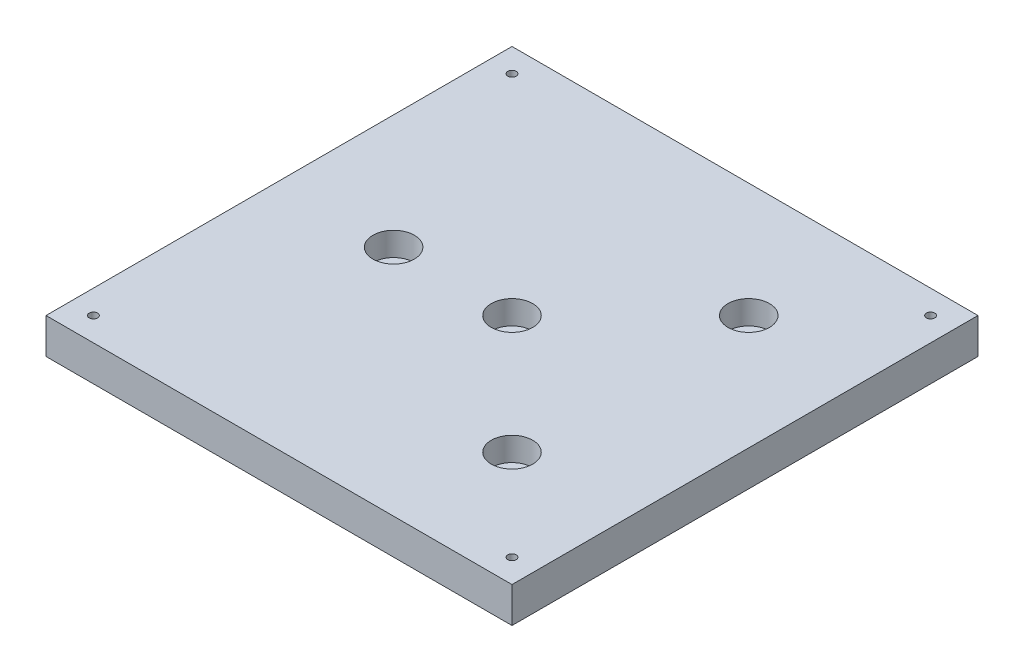
from build123d import *

# Parameters (mm, degrees)
PLATES_DIMS_W                                    = 125
PLATES_DIMS_H                                    = 125
PLATE_THICKNESS_DEPTH                            = 9.525
F_4_40_TAPPED_HOLE1_D                            = 2.2606
LPATTERN1_COUNT                                  = 2
LPATTERN1_PITCH                                  = 112.3
LPATTERN1_COUNT_DIR2                             = 2
LPATTERN1_PITCH_DIR2                             = 112.3
FLAT_DIMS_W                                      = 19.05
FLAT_DIMS_H                                      = 19.05
FLAT_CUT_LENGTH_DEPTH                            = 4.7112
CBORE_FOR_1_4_SOCKET_HEAD_CAP_SCREW1_D           = 6.7564
CBORE_FOR_1_4_SOCKET_HEAD_CAP_SCREW1_CBORE_D     = 11.1125
CBORE_FOR_1_4_SOCKET_HEAD_CAP_SCREW1_CBORE_DEPTH = 6.35


with BuildPart() as part:
    # Plates_Dims → Plate_Thickness (new body)
    with BuildSketch(Plane(origin=(0, 0, 0), x_dir=(1, 0, 0), z_dir=(0, 1, 0))):
        Rectangle(PLATES_DIMS_W, PLATES_DIMS_H)
    extrude(amount=PLATE_THICKNESS_DEPTH)

    # #4-40 Tapped Hole1 (through all)
    with Locations(Plane(origin=(56.15, 9.525, 56.15), x_dir=(0, 0, 1), z_dir=(0, 1, 0))):
        with Locations((0, 0)):
            f_4_40_tapped_hole1 = Hole(F_4_40_TAPPED_HOLE1_D / 2)

    # LPattern1: 4-40 Tapped Hole1 2 × 2
    with Locations(*[(-j * LPATTERN1_PITCH_DIR2, 0, -i * LPATTERN1_PITCH) for i in range(LPATTERN1_COUNT) for j in range(LPATTERN1_COUNT_DIR2) if (i, j) != (0, 0)]):
        add(f_4_40_tapped_hole1, mode=Mode.SUBTRACT)

    # Cone_Cut: read off the stored shape, not the designer's step
    # Cone_Cut: loft between two sections, ruled curve by curve
    cone_cut_from = [
        Edge.make_bspline([(-28.010369629, 0, 23.684811553), (-44.140746524, 0, 16.205550811), (-51.620007265, 0, 32.335927706), (-35.489630371, 0, 39.815188447), (-19.359253476, 0, 47.294449189), (-11.879992735, 0, 31.164072294), (-28.010369629, 0, 23.684811553)], [0, 0, 0, 0, 0.5, 0.5, 0.5, 1, 1, 1, 1], 3, [1, 0.333333333, 0.333333333, 1, 0.333333333, 0.333333333, 1]),
    ]
    cone_cut_to = [
        Edge.make_bspline([(-31.396446609, 6.35, 31.396446609), (-32.103553391, 6.35, 30.689339828), (-32.810660172, 6.35, 31.396446609), (-32.103553391, 6.35, 32.103553391), (-31.396446609, 6.35, 32.810660172), (-30.689339828, 6.35, 32.103553391), (-31.396446609, 6.35, 31.396446609)], [0, 0, 0, 0, 0.5, 0.5, 0.5, 1, 1, 1, 1], 3, [1, 0.333333333, 0.333333333, 1, 0.333333333, 0.333333333, 1]),
    ]
    cone_cut = Solid(Shell([*[Face.make_surface_from_curves(cone_cut_from[k], cone_cut_to[k]) for k in range(1)], Face(Wire(cone_cut_from)), Face(Wire(cone_cut_to))]))
    add(cone_cut, mode=Mode.SUBTRACT)

    # Bottom_Groove → Groove_Cut section 0
    with BuildSketch(Plane(origin=(0, 0, 0), x_dir=(1, 0, 0), z_dir=(0, 1, 0))):
        with BuildLine():
            Line((-40.64, 43.65625), (-22.86, 43.65625))
            Line((-22.86, 43.65625), (-22.86, 19.84375))
            Line((-22.86, 19.84375), (-40.64, 19.84375))
            Line((-40.64, 19.84375), (-40.64, 43.65625))
        make_face()
    # Top_Groove → Groove_Cut section 1
    with BuildSketch(Plane(origin=(0, 6.35, 0), x_dir=(-1, 0, 0), z_dir=(0, -1, 0))):
        with BuildLine():
            Line((32.25, 43.65625), (31.25, 43.65625))
            Line((31.25, 43.65625), (31.25, 19.84375))
            Line((31.25, 19.84375), (32.25, 19.84375))
            Line((32.25, 19.84375), (32.25, 43.65625))
        make_face()
    loft(mode=Mode.SUBTRACT)

    # Flat_Dims → Flat_Cut_Length (cut)
    with BuildSketch(Plane(origin=(0, 0, 0), x_dir=(1, 0, 0), z_dir=(0, 1, 0))):
        with Locations((31.75, 0)):
            Rectangle(FLAT_DIMS_W, FLAT_DIMS_H)
    extrude(amount=FLAT_CUT_LENGTH_DEPTH, mode=Mode.SUBTRACT)

    # CBORE for 1/4 Socket Head Cap Screw1 (through all)
    with Locations(Plane(origin=(-31.75, 9.525, 0), x_dir=(0, 0, 1), z_dir=(0, 1, 0))):
        with Locations((0, 0), (31.75, 63.5), (-31.75, 63.5), (0, 31.75)):
            CounterBoreHole(CBORE_FOR_1_4_SOCKET_HEAD_CAP_SCREW1_D / 2, CBORE_FOR_1_4_SOCKET_HEAD_CAP_SCREW1_CBORE_D / 2, CBORE_FOR_1_4_SOCKET_HEAD_CAP_SCREW1_CBORE_DEPTH)


solid = part.part
